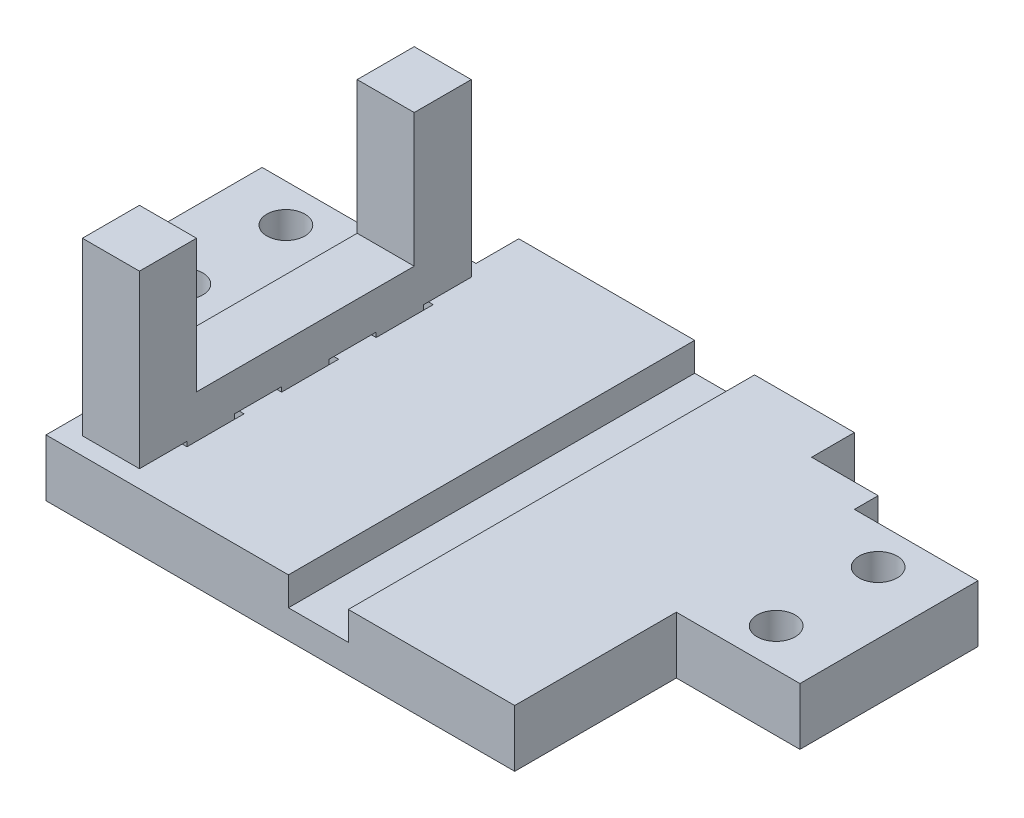
from build123d import *

# Parameters (mm, degrees)
SKETCH_2_W          = 75.3
SKETCH_2_H          = 6
EXTRUDE_1_DEPTH     = 18.73
SKETCH_3_R          = 2
CUT_EXTRUDE_1_DEPTH = 13.73
SKETCH_4_W          = 49.3
SKETCH_4_H          = 6
EXTRUDE_3_DEPTH     = 17
SKETCH_6_W          = 49.3
SKETCH_6_H          = 6
EXTRUDE_5_DEPTH     = 7
SKETCH_7_W          = 6
SKETCH_7_H          = 6
EXTRUDE_6_DEPTH     = 18
SKETCH_8_W          = 6.3
SKETCH_8_H          = 42.73
CUT_EXTRUDE_2_DEPTH = 3
SKETCH_9_W          = 7
SKETCH_9_H          = 4.5
CUT_EXTRUDE_3_DEPTH = 10
SKETCH_10_W         = 6
SKETCH_10_H         = 22.9
EXTRUDE_7_DEPTH     = 4
OTHER_START         = -22.65
OTHER_1_OUTLINE_W   = 6
OTHER_1_OUTLINE_H   = 5
OTHER_1_DEPTH       = 6
OTHER_START_2       = -23.15
OTHER_1_2_OUTLINE_W = 6
OTHER_1_2_OUTLINE_H = 6
OTHER_1_2_DEPTH     = 7


# Read off the part's stored shape, not the designer's step: Разделить1, Выступы и прорези-Выступ1, Выступы и прорези-Прорезь1
with BuildPart() as part:
    # Эскиз2 → Бобышка-Вытянуть1 (new body)
    with BuildSketch(Plane.XY):
        Rectangle(SKETCH_2_W, SKETCH_2_H)
    extrude(amount=EXTRUDE_1_DEPTH)

    # Эскиз3 → Вырез-Вытянуть1 (cut)
    with BuildSketch(Plane(origin=(0, 3, 0), x_dir=(1, 0, 0), z_dir=(0, 1, 0))):
        with Locations(Location((-31.15, -4, 0), (0, 0, 270))):
            Circle(SKETCH_3_R)
        with Locations(Location((-31.15, -14.73, 0), (0, 0, 270))):
            Circle(SKETCH_3_R)
        with Locations(Location((31.15, -14.73, 0), (0, 0, 270))):
            Circle(SKETCH_3_R)
        with Locations(Location((31.15, -4, 0), (0, 0, 270))):
            Circle(SKETCH_3_R)
    extrude(amount=-CUT_EXTRUDE_1_DEPTH, mode=Mode.SUBTRACT)

    # Эскиз4 → Бобышка-Вытянуть3 (add)
    with BuildSketch(Plane.XY.offset(18.73)):
        Rectangle(SKETCH_4_W, SKETCH_4_H)
    extrude(amount=EXTRUDE_3_DEPTH)

    # Эскиз6 → Бобышка-Вытянуть5 (add)
    with BuildSketch(Plane(origin=(0, 0, 0), x_dir=(-1, 0, 0), z_dir=(0, 0, -1))):
        Rectangle(SKETCH_6_W, SKETCH_6_H)
    extrude(amount=EXTRUDE_5_DEPTH)

    # Эскиз7 → Бобышка-Вытянуть6 (add)
    with BuildSketch(Plane(origin=(0, 3, 0), x_dir=(1, 0, 0), z_dir=(0, 1, 0))):
        with Locations((-19.65, -2)):
            Rectangle(SKETCH_7_W, SKETCH_7_H)
        with Locations((-19.65, -30.9)):
            Rectangle(SKETCH_7_W, SKETCH_7_H)
    extrude(amount=EXTRUDE_6_DEPTH)

    # Эскиз8 → Вырез-Вытянуть2 (cut)
    with BuildSketch(Plane(origin=(0, 3, -43.99), x_dir=(-1, 0, 0), z_dir=(0, 1, 0))):
        with Locations((-4, 58.355)):
            Rectangle(SKETCH_8_W, SKETCH_8_H)
    extrude(amount=-CUT_EXTRUDE_2_DEPTH, mode=Mode.SUBTRACT)

    # Эскиз9 → Вырез-Вытянуть3 (cut)
    with BuildSketch(Plane(origin=(0, 3, 0), x_dir=(1, 0, 0), z_dir=(0, 1, 0))):
        with Locations((-21.15, 4.75)):
            Rectangle(SKETCH_9_W, SKETCH_9_H)
        with Locations((21.15, 4.75)):
            Rectangle(SKETCH_9_W, SKETCH_9_H)
    extrude(amount=-CUT_EXTRUDE_3_DEPTH, mode=Mode.SUBTRACT)

    # Эскиз10 → Бобышка-Вытянуть7 (add)
    with BuildSketch(Plane(origin=(0, 3, 0), x_dir=(1, 0, 0), z_dir=(0, 1, 0))):
        with Locations((-19.65, -16.45)):
            Rectangle(SKETCH_10_W, SKETCH_10_H)
    extrude(amount=EXTRUDE_7_DEPTH)


with BuildPart() as body_2:
    # Split Bodies 1: the piece on the far side of the plane
    add(part.part)
    split(bisect_by=Plane(origin=(0, 3, 0), x_dir=(1, 0, 0), z_dir=(0, 1, 0)), keep=Keep.BOTTOM)

    # Other 1 2 outline → Other 1 2 (cut)
    with BuildSketch(Plane.YZ.offset(OTHER_START_2)):
        with Locations((0, 26.4)):
            Rectangle(OTHER_1_2_OUTLINE_W, OTHER_1_2_OUTLINE_H)
        with Locations((0, 16.45)):
            Rectangle(OTHER_1_2_OUTLINE_W, OTHER_1_2_OUTLINE_H)
        with Locations((0, 6.5)):
            Rectangle(OTHER_1_2_OUTLINE_W, OTHER_1_2_OUTLINE_H)
    extrude(amount=OTHER_1_2_DEPTH, mode=Mode.SUBTRACT)


with BuildPart() as part_1:
    add(part.part)

    # Split Bodies 1
    split(bisect_by=Plane(origin=(0, 3, 0), x_dir=(1, 0, 0), z_dir=(0, 1, 0)), keep=Keep.TOP)

    # Other 1 outline → Other 1 (add)
    with BuildSketch(Plane.YZ.offset(OTHER_START)):
        with Locations((0, 6.5)):
            Rectangle(OTHER_1_OUTLINE_W, OTHER_1_OUTLINE_H)
        with Locations((0, 16.45)):
            Rectangle(OTHER_1_OUTLINE_W, OTHER_1_OUTLINE_H)
        with Locations((0, 26.4)):
            Rectangle(OTHER_1_OUTLINE_W, OTHER_1_OUTLINE_H)
    extrude(amount=OTHER_1_DEPTH)


solid = Compound([body_2.part, part_1.part])
